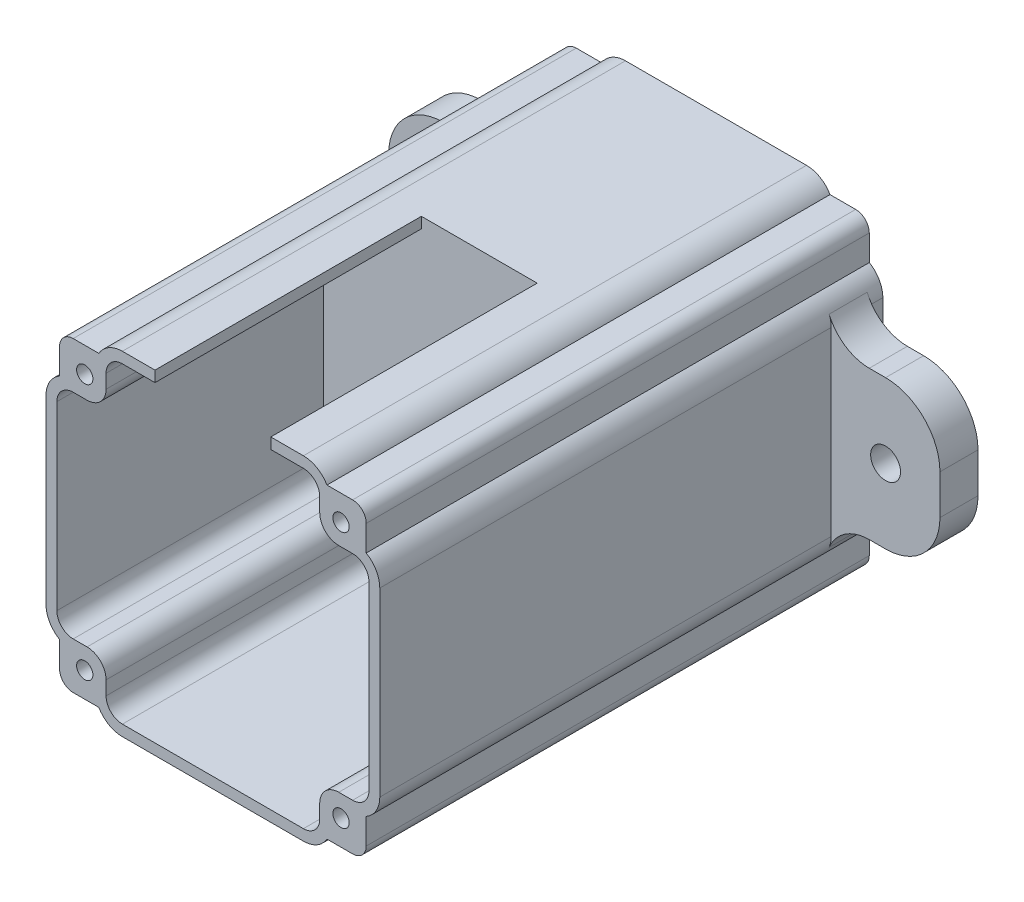
from build123d import *

# Parameters (mm, degrees)
BOSS_EXTRUDE1_DEPTH = 49
BOSS_EXTRUDE2_START = 1.5
BOSS_EXTRUDE2_DEPTH = 1.5
BOSS_EXTRUDE3_DEPTH = 50.5
SKETCH4_R           = 1.5
CUT_EXTRUDE1_DEPTH  = 10
BOSS_EXTRUDE4_START = 42.04
BOSS_EXTRUDE4_DEPTH = 42.04
SKETCH7_W           = 7
SKETCH7_H           = 27.3
BOSS_EXTRUDE5_DEPTH = 20
FILLET1_R           = 10
FILLET2_R           = 8
FILLET3_R           = 10
FILLET4_R           = 8
SKETCH8_R           = 2.75
CUT_EXTRUDE2_DEPTH  = 9.5


with BuildPart() as part:
    # Sketch1 → Boss-Extrude1 (new body)
    with BuildSketch(Plane(origin=(0, 0, -54), x_dir=(-1, 0, 0), z_dir=(0, 0, -1))):
        with BuildLine():
            Line((-25.7, -19.65), (-23.15, -19.65))
            ThreePointArc((-23.15, -19.65), (-20.675126266, -20.675126266), (-19.65, -23.15))
            Line((-19.65, -23.15), (-19.65, -25.7))
            ThreePointArc((-19.65, -25.7), (-18.771320344, -27.821320344), (-16.65, -28.7))
            Line((-16.65, -28.7), (16.65, -28.7))
            ThreePointArc((16.65, -28.7), (18.771320344, -27.821320344), (19.65, -25.7))
            Line((19.65, -25.7), (19.65, -23.15))
            ThreePointArc((19.65, -23.15), (20.675126266, -20.675126266), (23.15, -19.65))
            Line((23.15, -19.65), (25.7, -19.65))
            ThreePointArc((25.7, -19.65), (27.821320344, -18.771320344), (28.7, -16.65))
            Line((28.7, -16.65), (28.7, 16.65))
            ThreePointArc((28.7, 16.65), (27.821320344, 18.771320344), (25.7, 19.65))
            Line((25.7, 19.65), (23.15, 19.65))
            ThreePointArc((23.15, 19.65), (20.675126266, 20.675126266), (19.65, 23.15))
            Line((19.65, 23.15), (19.65, 25.7))
            ThreePointArc((19.65, 25.7), (18.771320344, 27.821320344), (16.65, 28.7))
            Line((16.65, 28.7), (10.65, 28.7))
            Line((10.65, 28.7), (10.65, 30.7))
            Line((10.65, 30.7), (16.65, 30.7))
            ThreePointArc((16.65, 30.7), (20.185533906, 29.235533906), (21.65, 25.7))
            Line((21.65, 25.7), (21.65, 23.15))
            ThreePointArc((21.65, 23.15), (22.089339828, 22.089339828), (23.15, 21.65))
            Line((23.15, 21.65), (25.7, 21.65))
            ThreePointArc((25.7, 21.65), (29.235533906, 20.185533906), (30.7, 16.65))
            Line((30.7, 16.65), (30.7, -16.65))
            ThreePointArc((30.7, -16.65), (29.235533906, -20.185533906), (25.7, -21.65))
            Line((25.7, -21.65), (23.15, -21.65))
            ThreePointArc((23.15, -21.65), (22.089339828, -22.089339828), (21.65, -23.15))
            Line((21.65, -23.15), (21.65, -25.7))
            ThreePointArc((21.65, -25.7), (20.185533906, -29.235533906), (16.65, -30.7))
            Line((16.65, -30.7), (-16.65, -30.7))
            ThreePointArc((-16.65, -30.7), (-20.185533906, -29.235533906), (-21.65, -25.7))
            Line((-21.65, -25.7), (-21.65, -23.15))
            ThreePointArc((-21.65, -23.15), (-22.089339828, -22.089339828), (-23.15, -21.65))
            Line((-23.15, -21.65), (-25.7, -21.65))
            ThreePointArc((-25.7, -21.65), (-29.235533906, -20.185533906), (-30.7, -16.65))
            Line((-30.7, -16.65), (-30.7, 16.65))
            ThreePointArc((-30.7, 16.65), (-29.235533906, 20.185533906), (-25.7, 21.65))
            Line((-25.7, 21.65), (-23.15, 21.65))
            ThreePointArc((-23.15, 21.65), (-22.089339828, 22.089339828), (-21.65, 23.15))
            Line((-21.65, 23.15), (-21.65, 25.7))
            ThreePointArc((-21.65, 25.7), (-20.185533906, 29.235533906), (-16.65, 30.7))
            Line((-16.65, 30.7), (-10.65, 30.7))
            Line((-10.65, 30.7), (-10.65, 28.7))
            Line((-10.65, 28.7), (-16.65, 28.7))
            ThreePointArc((-16.65, 28.7), (-18.771320344, 27.821320344), (-19.65, 25.7))
            Line((-19.65, 25.7), (-19.65, 23.15))
            ThreePointArc((-19.65, 23.15), (-20.675126266, 20.675126266), (-23.15, 19.65))
            Line((-23.15, 19.65), (-25.7, 19.65))
            ThreePointArc((-25.7, 19.65), (-27.821320344, 18.771320344), (-28.7, 16.65))
            Line((-28.7, 16.65), (-28.7, -16.65))
            ThreePointArc((-28.7, -16.65), (-27.821320344, -18.771320344), (-25.7, -19.65))
        make_face()
    extrude(amount=-BOSS_EXTRUDE1_DEPTH)

    # Sketch2 → Boss-Extrude2 (add)
    with BuildSketch(Plane(origin=(0, 0, -54), x_dir=(-1, 0, 0), z_dir=(0, 0, -1)).offset(BOSS_EXTRUDE2_START)):
        with BuildLine():
            Line((-10.65, 30.7), (10.65, 30.7))
            Line((10.65, 30.7), (16.65, 30.7))
            ThreePointArc((16.65, 30.7), (20.185533906, 29.235533906), (21.65, 25.7))
            Line((21.65, 25.7), (21.65, 23.15))
            ThreePointArc((21.65, 23.15), (22.089339828, 22.089339828), (23.15, 21.65))
            Line((23.15, 21.65), (25.7, 21.65))
            ThreePointArc((25.7, 21.65), (29.235533906, 20.185533906), (30.7, 16.65))
            Line((30.7, 16.65), (30.7, -16.65))
            ThreePointArc((30.7, -16.65), (29.235533906, -20.185533906), (25.7, -21.65))
            Line((25.7, -21.65), (23.15, -21.65))
            ThreePointArc((23.15, -21.65), (22.089339828, -22.089339828), (21.65, -23.15))
            Line((21.65, -23.15), (21.65, -25.7))
            ThreePointArc((21.65, -25.7), (20.185533906, -29.235533906), (16.65, -30.7))
            Line((16.65, -30.7), (-16.65, -30.7))
            ThreePointArc((-16.65, -30.7), (-20.185533906, -29.235533906), (-21.65, -25.7))
            Line((-21.65, -25.7), (-21.65, -23.15))
            ThreePointArc((-21.65, -23.15), (-22.089339828, -22.089339828), (-23.15, -21.65))
            Line((-23.15, -21.65), (-25.7, -21.65))
            ThreePointArc((-25.7, -21.65), (-29.235533906, -20.185533906), (-30.7, -16.65))
            Line((-30.7, -16.65), (-30.7, 16.65))
            ThreePointArc((-30.7, 16.65), (-29.235533906, 20.185533906), (-25.7, 21.65))
            Line((-25.7, 21.65), (-23.15, 21.65))
            ThreePointArc((-23.15, 21.65), (-22.089339828, 22.089339828), (-21.65, 23.15))
            Line((-21.65, 23.15), (-21.65, 25.7))
            ThreePointArc((-21.65, 25.7), (-20.185533906, 29.235533906), (-16.65, 30.7))
            Line((-16.65, 30.7), (-10.65, 30.7))
        make_face()
    extrude(amount=-BOSS_EXTRUDE2_DEPTH)

    # Sketch3 → Boss-Extrude3 (add)
    with BuildSketch(Plane(origin=(0, 0, -55.5), x_dir=(-1, 0, 0), z_dir=(0, 0, -1))):
        with BuildLine():
            Line((-21.65, 23.15), (-21.65, 25.7))
            ThreePointArc((-21.65, 25.7), (-21.479629131, 26.994095226), (-20.980127019, 28.2))
            Line((-20.980127019, 28.2), (-25.7, 28.2))
            ThreePointArc((-25.7, 28.2), (-27.467766953, 27.467766953), (-28.2, 25.7))
            Line((-28.2, 25.7), (-28.2, 20.980127019))
            ThreePointArc((-28.2, 20.980127019), (-26.994095226, 21.479629131), (-25.7, 21.65))
            Line((-25.7, 21.65), (-23.15, 21.65))
            ThreePointArc((-23.15, 21.65), (-22.089339828, 22.089339828), (-21.65, 23.15))
        make_face()
        with BuildLine():
            Line((21.65, 25.7), (21.65, 23.15))
            ThreePointArc((21.65, 23.15), (22.089339828, 22.089339828), (23.15, 21.65))
            Line((23.15, 21.65), (25.7, 21.65))
            ThreePointArc((25.7, 21.65), (26.994095226, 21.479629131), (28.2, 20.980127019))
            Line((28.2, 20.980127019), (28.2, 25.7))
            ThreePointArc((28.2, 25.7), (27.467766953, 27.467766953), (25.7, 28.2))
            Line((25.7, 28.2), (20.980127019, 28.2))
            ThreePointArc((20.980127019, 28.2), (21.479629131, 26.994095226), (21.65, 25.7))
        make_face()
        with BuildLine():
            Line((-23.15, -21.65), (-25.7, -21.65))
            ThreePointArc((-25.7, -21.65), (-26.994095226, -21.479629131), (-28.2, -20.980127019))
            Line((-28.2, -20.980127019), (-28.2, -25.7))
            ThreePointArc((-28.2, -25.7), (-27.467766953, -27.467766953), (-25.7, -28.2))
            Line((-25.7, -28.2), (-20.980127019, -28.2))
            ThreePointArc((-20.980127019, -28.2), (-21.479629131, -26.994095226), (-21.65, -25.7))
            Line((-21.65, -25.7), (-21.65, -23.15))
            ThreePointArc((-21.65, -23.15), (-22.089339828, -22.089339828), (-23.15, -21.65))
        make_face()
        with BuildLine():
            Line((20.980127019, -28.2), (25.7, -28.2))
            ThreePointArc((25.7, -28.2), (27.467766953, -27.467766953), (28.2, -25.7))
            Line((28.2, -25.7), (28.2, -20.980127019))
            ThreePointArc((28.2, -20.980127019), (26.994095226, -21.479629131), (25.7, -21.65))
            Line((25.7, -21.65), (23.15, -21.65))
            ThreePointArc((23.15, -21.65), (22.089339828, -22.089339828), (21.65, -23.15))
            Line((21.65, -23.15), (21.65, -25.7))
            ThreePointArc((21.65, -25.7), (21.479629131, -26.994095226), (20.980127019, -28.2))
        make_face()
    extrude(amount=-BOSS_EXTRUDE3_DEPTH)

    # Sketch4 → Cut-Extrude1 (cut)
    with BuildSketch(Plane.XY.offset(-5)):
        with Locations((-23.57, 23.57)):
            Circle(SKETCH4_R)
        with Locations((23.57, 23.57)):
            Circle(SKETCH4_R)
        with Locations((-23.57, -23.57)):
            Circle(SKETCH4_R)
        with Locations((23.57, -23.57)):
            Circle(SKETCH4_R)
    extrude(amount=-CUT_EXTRUDE1_DEPTH, mode=Mode.SUBTRACT)

    # Sketch5 → Boss-Extrude4 (add)
    with BuildSketch(Plane(origin=(0, 0, -55.5), x_dir=(-1, 0, 0), z_dir=(0, 0, -1)).offset(BOSS_EXTRUDE4_START)):
        with BuildLine():
            Line((28.2, -25.7), (28.2, -20.980127019))
            ThreePointArc((28.2, -20.980127019), (30.030127019, -19.15), (30.7, -16.65))
            Line((30.7, -16.65), (30.7, 16.65))
            ThreePointArc((30.7, 16.65), (30.030127019, 19.15), (28.2, 20.980127019))
            Line((28.2, 20.980127019), (28.2, 25.7))
            ThreePointArc((28.2, 25.7), (27.467766953, 27.467766953), (25.7, 28.2))
            Line((25.7, 28.2), (20.980127019, 28.2))
            ThreePointArc((20.980127019, 28.2), (19.15, 30.030127019), (16.65, 30.7))
            Line((16.65, 30.7), (-16.65, 30.7))
            ThreePointArc((-16.65, 30.7), (-19.15, 30.030127019), (-20.980127019, 28.2))
            Line((-20.980127019, 28.2), (-25.7, 28.2))
            ThreePointArc((-25.7, 28.2), (-27.467766953, 27.467766953), (-28.2, 25.7))
            Line((-28.2, 25.7), (-28.2, 20.980127019))
            ThreePointArc((-28.2, 20.980127019), (-30.030127019, 19.15), (-30.7, 16.65))
            Line((-30.7, 16.65), (-30.7, -16.65))
            ThreePointArc((-30.7, -16.65), (-30.030127019, -19.15), (-28.2, -20.980127019))
            Line((-28.2, -20.980127019), (-28.2, -25.7))
            ThreePointArc((-28.2, -25.7), (-27.467766953, -27.467766953), (-25.7, -28.2))
            Line((-25.7, -28.2), (-20.980127019, -28.2))
            ThreePointArc((-20.980127019, -28.2), (-19.15, -30.030127019), (-16.65, -30.7))
            Line((-16.65, -30.7), (16.65, -30.7))
            ThreePointArc((16.65, -30.7), (19.15, -30.030127019), (20.980127019, -28.2))
            Line((20.980127019, -28.2), (25.7, -28.2))
            ThreePointArc((25.7, -28.2), (27.467766953, -27.467766953), (28.2, -25.7))
        make_face()
    extrude(amount=-BOSS_EXTRUDE4_DEPTH)

    # Sketch7 → Boss-Extrude5 (add)
    with BuildSketch(Plane(origin=(30.7, 0, 0), x_dir=(0, 0, -1), z_dir=(1, 0, 0))):
        with Locations((91.54, 0)):
            Rectangle(SKETCH7_W, SKETCH7_H)
    boss_extrude5 = extrude(amount=BOSS_EXTRUDE5_DEPTH)

    # Fillet1
    fillet1_edges = [part.edges().sort_by_distance(p)[0] for p in [
        (50.7, 13.65, -91.54),
        (50.7, -13.65, -91.54),
    ]]
    fillet(fillet1_edges, radius=FILLET1_R)

    # Fillet2
    # the kernel refuses this fillet: 8 mm, written as the material it adds along each edge
    with BuildSketch(Plane(origin=(30.7, 13.65, -95.04), x_dir=(-0.07788766729291054, 0.9969621413492434, 0), z_dir=(0, 0, 1))) as fillet2_piece_1:
        with BuildLine():
            CenterArc((7.43048346, -7.601836328), FILLET2_R, 108.152705887, 67.380135052)
            Line((-0.545213671, -6.978734989), (-1.342783384, -6.916424856))
            Line((-1.342783384, -6.916424856), (-0.797569713, 0.062310134))
            Line((-0.797569713, 0.062310134), (0.062310134, 0.797569713))
            ThreePointArc((0.062310134, 0.797569713), (3.053196558, 0.563906711), (4.688837571, 0.760183633))
            Line((4.688837571, 0.760183633), (4.938078106, 0))
        make_face()
    extrude(amount=7)
    with BuildSketch(Plane(origin=(30.7, -13.65, -88.04), x_dir=(1, 0, 0), z_dir=(0, 0, -1))) as fillet2_piece_2:
        with BuildLine():
            CenterArc((7, 8), FILLET2_R, 202.619864948, 67.380135052)
            Line((-0.384615385, 4.923076923), (-1.123076923, 4.615384615))
            ThreePointArc((-1.123076923, 4.615384615), (-0.8, 3), (-0.8, 0))
            Line((-0.8, 0), (0, -0.8))
            Line((0, -0.8), (7, -0.8))
            Line((7, -0.8), (7, 0))
        make_face()
    extrude(amount=7)

    # Mirror1: Boss-Extrude5 across plane
    add(boss_extrude5.mirror(Plane(origin=(0, 0, 0), x_dir=(0, 0, 1), z_dir=(1, 0, 0))))

    # Fillet3
    fillet3_edges = [part.edges().sort_by_distance(p)[0] for p in [
        (-50.7, -13.65, -91.54),
        (-50.7, 13.65, -91.54),
    ]]
    fillet(fillet3_edges, radius=FILLET3_R)

    # Fillet4
    # the kernel refuses this fillet: 8 mm, written as the material it adds along each edge
    with BuildSketch(Plane(origin=(-30.7, 13.65, -95.04), x_dir=(-1, 0, 0), z_dir=(0, 0, 1))) as fillet4_piece_1:
        with BuildLine():
            CenterArc((7, -8), FILLET4_R, 90, 67.380135052)
            Line((-0.384615385, -4.923076923), (-1.123076923, -4.615384615))
            ThreePointArc((-1.123076923, -4.615384615), (-0.8, -3), (-0.8, 0))
            Line((-0.8, 0), (0, 0.8))
            Line((0, 0.8), (7, 0.8))
            Line((7, 0.8), (7, 0))
        make_face()
    extrude(amount=7)
    with BuildSketch(Plane(origin=(-30.7, -13.65, -88.04), x_dir=(0.07788766729291037, -0.9969621413492434, 0), z_dir=(0, 0, -1))) as fillet4_piece_2:
        with BuildLine():
            CenterArc((7.43048346, 7.601836328), FILLET4_R, 184.467159061, 67.380135052)
            Line((-0.545213671, 6.978734989), (-1.342783384, 6.916424856))
            Line((-1.342783384, 6.916424856), (-0.797569713, -0.062310134))
            Line((-0.797569713, -0.062310134), (0.062310134, -0.797569713))
            ThreePointArc((0.062310134, -0.797569713), (3.053196558, -0.563906711), (4.688837571, -0.760183633))
            Line((4.688837571, -0.760183633), (4.938078106, 0))
        make_face()
    extrude(amount=7)

    # Sketch8 → Cut-Extrude2 (cut)
    with BuildSketch(Plane.XY.offset(-88.04)):
        with Locations((40.7, 0)):
            Circle(SKETCH8_R)
        with Locations((-40.7, 0)):
            Circle(SKETCH8_R)
    extrude(amount=-CUT_EXTRUDE2_DEPTH, mode=Mode.SUBTRACT)


solid = part.part
